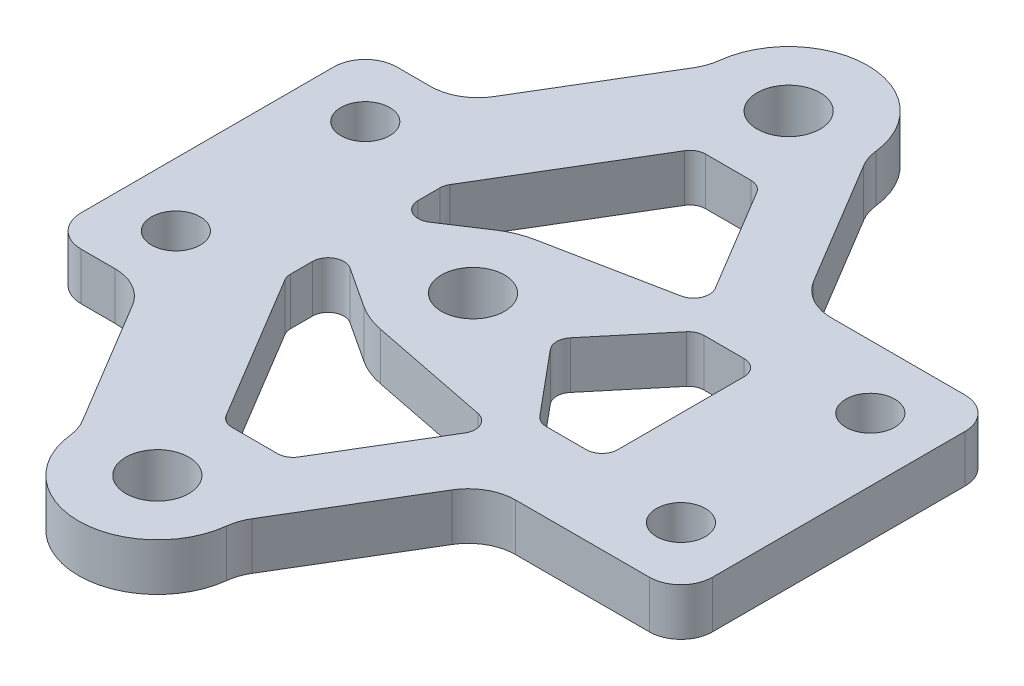
from build123d import *
from OCP.BRepFilletAPI import BRepFilletAPI_MakeChamfer

# Parameters (mm, degrees)
SKETCH_1_W           = 40
SKETCH_1_H           = 20
SKETCH_1_R           = 1.55
SKETCH_1_W_2         = 20
SKETCH_1_H_2         = 10
EXTRUDE_1_DEPTH      = 3
SKETCH_2_R           = 2
EXTRUDE_2_DEPTH      = 3
FILLET_1_R           = 2
SKETCH_3_W           = 10
SKETCH_3_H           = 10
CUT_EXTRUDE_1_DEPTH  = 33.155870382
CHAMFER_1_SIZE       = 6
CHAMFER_1_SIZE_2     = 10
FILLET_2_OUTLINE_R   = 2
FILLET_2_OUTLINE_R_2 = 1.55
FILLET_2_OUTLINE_W   = 20
FILLET_2_OUTLINE_H   = 10
FILLET_2_DEPTH       = 3
CUT_EXTRUDE_2_DEPTH  = 33.155870382
SKETCH_5_R           = 2
EXTRUDE_3_DEPTH      = 3
FILLET_3_R           = 1
SKETCH_6_R           = 2
EXTRUDE_4_DEPTH      = 3
SKETCH_7_R           = 2
CUT_EXTRUDE_3_DEPTH  = 33.155870382


with BuildPart() as part:
    # 草图1 → 凸台-拉伸1 (new body)
    with BuildSketch(Plane(origin=(0, 0, 0), x_dir=(1, 0, 0), z_dir=(0, 1, 0))):
        Rectangle(SKETCH_1_W, SKETCH_1_H)
        with Locations(Location((-16, 6, 0), (0, 0, 270))):
            Circle(SKETCH_1_R, mode=Mode.SUBTRACT)
        with Locations(Location((16, 6, 0), (0, 0, 90))):
            Circle(SKETCH_1_R, mode=Mode.SUBTRACT)
        with Locations(Location((16, -6, 0), (0, 0, 270))):
            Circle(SKETCH_1_R, mode=Mode.SUBTRACT)
        with Locations(Location((-16, -6, 0), (0, 0, 90))):
            Circle(SKETCH_1_R, mode=Mode.SUBTRACT)
        Rectangle(SKETCH_1_W_2, SKETCH_1_H_2, mode=Mode.SUBTRACT)
    extrude(amount=EXTRUDE_1_DEPTH)

    # 草图2 → 凸台-拉伸2 (add, through all)
    with BuildSketch(Plane(origin=(0, 3, 0), x_dir=(1, 0, 0), z_dir=(0, 1, 0))):
        with BuildLine():
            Line((-8.17, 20), (-8.17, -20))
            ThreePointArc((-8.17, -20), (-3.17, -25), (1.83, -20))
            Line((1.83, -20), (1.83, 20))
            ThreePointArc((1.83, 20), (-3.17, 25), (-8.17, 20))
        make_face()
        with Locations(Location((-3.17, 20, 0), (0, 0, 270))):
            Circle(SKETCH_2_R, mode=Mode.SUBTRACT)
        with Locations(Location((-3.17, -20, 0), (0, 0, 270))):
            Circle(SKETCH_2_R, mode=Mode.SUBTRACT)
    extrude(amount=-EXTRUDE_2_DEPTH)

    # 圆角1
    fillet_1_edges = [part.edges().sort_by_distance(p)[0] for p in [
        (20, 1.5, 10),
        (-20, 1.5, 10),
        (-20, 1.5, -10),
        (20, 1.5, -10),
    ]]
    fillet(fillet_1_edges, radius=FILLET_1_R)

    # 草图3 → 切除-拉伸1 (cut, through all)
    with BuildSketch(Plane(origin=(0, 3, 0), x_dir=(1, 0, 0), z_dir=(0, 1, 0))):
        with Locations((-3.17, 0)):
            Rectangle(SKETCH_3_W, SKETCH_3_H)
    extrude(amount=-CUT_EXTRUDE_1_DEPTH, mode=Mode.SUBTRACT)

    # 倒角1
    chamfer_1_edges_1 = [part.edges().sort_by_distance(p)[0] for p in [
        (-8.17, 1.5, 10),
    ]]
    chamfer_1_side_1 = [part.faces().sort_by_distance(p)[0] for p in [
        (-8.29, 1.5, 10),
    ]]
    chamfer_1_edges_2 = [part.edges().sort_by_distance(p)[0] for p in [
        (1.83, 1.5, 10),
    ]]
    chamfer_1_side_2 = [part.faces().sort_by_distance(p)[0] for p in [
        (1.95, 1.5, 10),
    ]]
    chamfer_1_edges_3 = [part.edges().sort_by_distance(p)[0] for p in [
        (1.83, 1.5, -10),
    ]]
    chamfer_1_side_3 = [part.faces().sort_by_distance(p)[0] for p in [
        (1.83, 1.5, -10.12),
    ]]
    chamfer_1_edges_4 = [part.edges().sort_by_distance(p)[0] for p in [
        (-8.17, 1.5, -10),
    ]]
    chamfer_1_side_4 = [part.faces().sort_by_distance(p)[0] for p in [
        (-8.29, 1.5, -10),
    ]]
    chamfer_1 = BRepFilletAPI_MakeChamfer(part.part.solid().wrapped)
    for e in chamfer_1_edges_1:
        chamfer_1.Add(CHAMFER_1_SIZE - 0.0001, CHAMFER_1_SIZE_2 - 0.0001, e.wrapped, chamfer_1_side_1[0].wrapped)
    for e in chamfer_1_edges_2:
        chamfer_1.Add(CHAMFER_1_SIZE - 0.0001, CHAMFER_1_SIZE_2 - 0.0001, e.wrapped, chamfer_1_side_2[0].wrapped)
    for e in chamfer_1_edges_3:
        chamfer_1.Add(CHAMFER_1_SIZE_2 - 0.0001, CHAMFER_1_SIZE - 0.0001, e.wrapped, chamfer_1_side_3[0].wrapped)
    for e in chamfer_1_edges_4:
        chamfer_1.Add(CHAMFER_1_SIZE - 0.0001, CHAMFER_1_SIZE_2 - 0.0001, e.wrapped, chamfer_1_side_4[0].wrapped)
    add(Compound.cast(chamfer_1.Shape()), mode=Mode.REPLACE)  # a hair under: the kernel refuses the full size

    # 圆角2: read off the stored shape, not the designer's step
    # 圆角2 outline → 圆角2 (add)
    with BuildSketch(Plane(origin=(0, 0, 0), x_dir=(1, 0, 0), z_dir=(0, 1, 0))):
        with BuildLine():
            ThreePointArc((18, -10), (19.414213562, -9.414213562), (20, -8))
            Line((20, -8), (20, 8))
            ThreePointArc((20, 8), (19.414213562, 9.414213562), (18, 10))
            Line((18, 10), (9.528571137, 10))
            ThreePointArc((9.528571137, 10), (8.050474692, 10.38940028), (6.95609236, 11.456512734))
            Line((6.95609236, 11.456512734), (2.204529459, 19.375784235))
            ThreePointArc((2.204529459, 19.375784235), (1.9367411, 19.953413027), (1.796880148, 20.574544688))
            ThreePointArc((1.796880148, 20.574544688), (-3.17, 25), (-8.136880148, 20.574544688))
            ThreePointArc((-8.136880148, 20.574544688), (-8.2767411, 19.953413027), (-8.544529459, 19.375784235))
            Line((-8.544529459, 19.375784235), (-13.29609236, 11.456512734))
            ThreePointArc((-13.29609236, 11.456512734), (-14.390474692, 10.38940028), (-15.868571137, 10))
            Line((-15.868571137, 10), (-18, 10))
            ThreePointArc((-18, 10), (-19.414213562, 9.414213562), (-20, 8))
            Line((-20, 8), (-20, -8))
            ThreePointArc((-20, -8), (-19.414213562, -9.414213562), (-18, -10))
            Line((-18, -10), (-15.868571137, -10))
            ThreePointArc((-15.868571137, -10), (-14.390474692, -10.38940028), (-13.29609236, -11.456512734))
            Line((-13.29609236, -11.456512734), (-8.544529459, -19.375784235))
            ThreePointArc((-8.544529459, -19.375784235), (-8.2767411, -19.953413027), (-8.136880148, -20.574544688))
            ThreePointArc((-8.136880148, -20.574544688), (-3.17, -25), (1.796880148, -20.574544688))
            ThreePointArc((1.796880148, -20.574544688), (1.9367411, -19.953413027), (2.204529459, -19.375784235))
            Line((2.204529459, -19.375784235), (6.95609236, -11.456512734))
            ThreePointArc((6.95609236, -11.456512734), (8.050474692, -10.38940028), (9.528571137, -10))
            Line((9.528571137, -10), (18, -10))
        make_face()
        with Locations((-3.17, -20)):
            Circle(FILLET_2_OUTLINE_R, mode=Mode.SUBTRACT)
        with Locations((-16, -6)):
            Circle(FILLET_2_OUTLINE_R_2, mode=Mode.SUBTRACT)
        with Locations((16, -6)):
            Circle(FILLET_2_OUTLINE_R_2, mode=Mode.SUBTRACT)
        with Locations((-16, 6)):
            Circle(FILLET_2_OUTLINE_R_2, mode=Mode.SUBTRACT)
        with Locations((-3.17, 20)):
            Circle(FILLET_2_OUTLINE_R, mode=Mode.SUBTRACT)
        Rectangle(FILLET_2_OUTLINE_W, FILLET_2_OUTLINE_H, mode=Mode.SUBTRACT)
        with Locations((16, 6)):
            Circle(FILLET_2_OUTLINE_R_2, mode=Mode.SUBTRACT)
    extrude(amount=FILLET_2_DEPTH)

    # 草图4 → 切除-拉伸2 (cut, through all)
    with BuildSketch(Plane(origin=(0, 3, 0), x_dir=(1, 0, 0), z_dir=(0, 1, 0))):
        Polygon((-10, 5), (-4, 15), (0, 15), (6, 5), align=None)
        Polygon((-10, -5), (6, -5), (0, -15), (-4, -15), align=None)
    extrude(amount=-CUT_EXTRUDE_2_DEPTH, mode=Mode.SUBTRACT)

    # 草图5 → 凸台-拉伸3 (add, through all)
    with BuildSketch(Plane(origin=(0, 3, 0), x_dir=(1, 0, 0), z_dir=(0, 1, 0))):
        with BuildLine():
            Line((-10, 1.5), (-5.912088761, 4.18102251))
            ThreePointArc((-5.912088761, 4.18102251), (-5.06302182, 4.627793036), (-4.144252411, 4.904164785))
            Line((-4.144252411, 4.904164785), (4.971008489, 6.714985851))
            Line((4.971008489, 6.714985851), (6, 5))
            Line((6, 5), (1.83, 0))
            Line((1.83, 0), (6, -5))
            Line((6, -5), (4.971008489, -6.714985851))
            Line((4.971008489, -6.714985851), (-4.144252411, -4.904164785))
            ThreePointArc((-4.144252411, -4.904164785), (-5.06302182, -4.627793036), (-5.912088761, -4.18102251))
            Line((-5.912088761, -4.18102251), (-10, -1.5))
            Line((-10, -1.5), (-10, 1.5))
        make_face()
        with Locations(Location((-3.17, 0, 0), (0, 0, 270))):
            Circle(SKETCH_5_R, mode=Mode.SUBTRACT)
    extrude(amount=-EXTRUDE_3_DEPTH)

    # 圆角3
    fillet_3_edges = [part.edges().sort_by_distance(p)[0] for p in [
        (6, 1.5, -5),
        (-4, 1.5, -15),
        (0, 1.5, -15),
        (-4, 1.5, 15),
        (6, 1.5, 5),
        (0, 1.5, 15),
        (-10, 1.5, 1.5),
        (-10, 1.5, -1.5),
        (4.971008489, 1.5, -6.714985851),
        (1.83, 1.5, 0),
        (4.971008489, 1.5, 6.714985851),
        (10, 1.5, 5),
        (10, 1.5, -5),
        (-10, 1.5, -5),
        (-10, 1.5, 5),
    ]]
    fillet(fillet_3_edges, radius=FILLET_3_R)

    # 草图6 → 凸台-拉伸4 (add, through all)
    with BuildSketch(Plane(origin=(0, 3, 0), x_dir=(1, 0, 0), z_dir=(0, 1, 0))):
        with Locations((-3.17, -20)):
            Circle(SKETCH_6_R)
        with Locations((-3.17, 0)):
            Circle(SKETCH_6_R)
        with Locations((-3.17, 20)):
            Circle(SKETCH_6_R)
    extrude(amount=-EXTRUDE_4_DEPTH)

    # 草图7 → 切除-拉伸3 (cut, through all)
    with BuildSketch(Plane(origin=(0, 3, 0), x_dir=(1, 0, 0), z_dir=(0, 1, 0))):
        with Locations(Location((-3.175, 20, 0), (0, 0, 270))):
            Circle(SKETCH_7_R)
        with Locations(Location((-3.175, 0, 0), (0, 0, 270))):
            Circle(SKETCH_7_R)
        with Locations(Location((-3.175, -20, 0), (0, 0, 270))):
            Circle(SKETCH_7_R)
    extrude(amount=-CUT_EXTRUDE_3_DEPTH, mode=Mode.SUBTRACT)


solid = part.part
